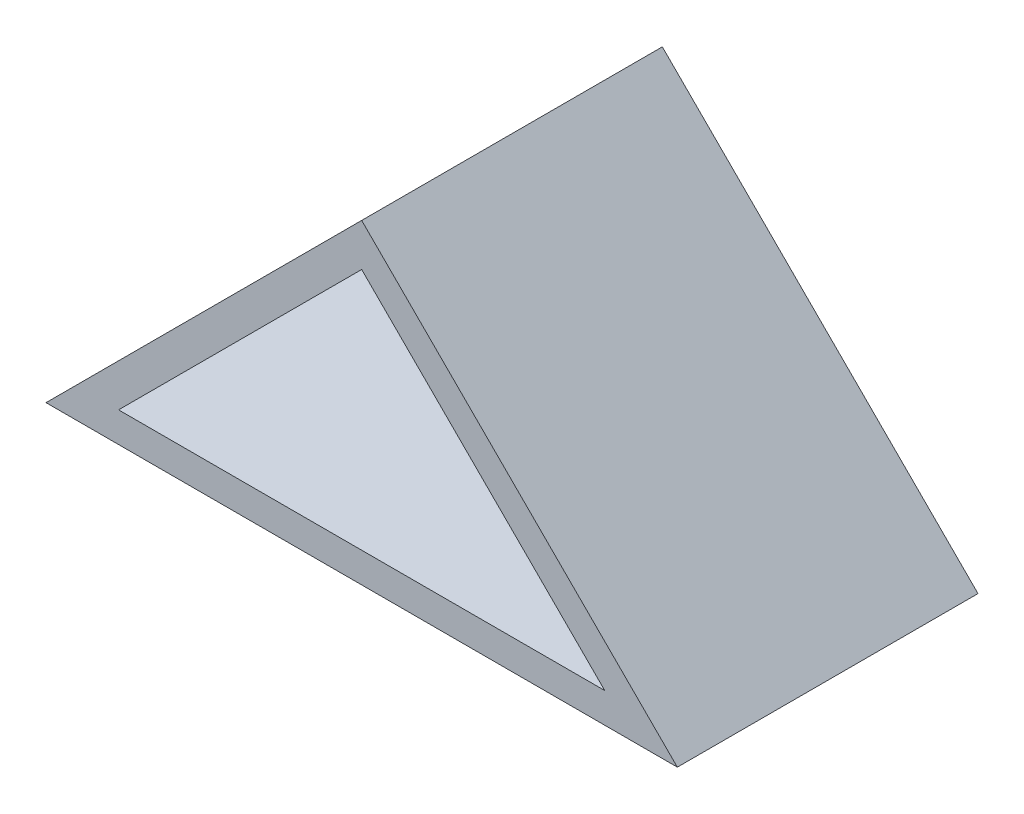
from build123d import *

# Parameters (mm, degrees)
BOSS_EXTRUDE1_DEPTH = 20


with BuildPart() as part:
    # Sketch1 → Boss-Extrude1 (new, symmetric)
    with BuildSketch(Plane.XY):
        Polygon((0, 0), (-42, -42), (42, -42), align=None)
        Polygon((-32.343145751, -38), (0, -5.656854249), (32.343145751, -38), align=None, mode=Mode.SUBTRACT)
    extrude(amount=BOSS_EXTRUDE1_DEPTH, both=True)


solid = part.part
